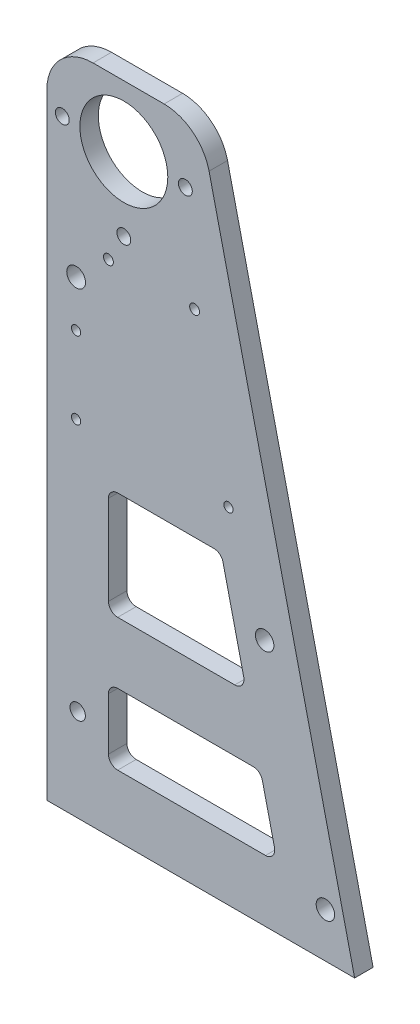
from build123d import *

# Parameters (mm, degrees)
ESBO_O1_R                = 14.2875
ESBO_O1_R_2              = 2.5
RESSALTO_EXTRUS_O2_DEPTH = 6
FILETE1_R                = 15
ESBO_O3_R                = 1.5
ESBO_O3_R_2              = 3
ESBO_O3_R_3              = 3.05
CORTE_EXTRUS_O1_DEPTH    = 238.194013415
ESBO_O5_R                = 2.25
ESBO_O5_R_2              = 3
ESBO_O5_R_3              = 1.6
CORTE_EXTRUS_O2_DEPTH    = 238.194013415


with BuildPart() as part:
    # Esboço1 → Ressalto-extrusão2 (new body)
    with BuildSketch(Plane.XY):
        Polygon((0, 0), (0, 215), (50, 215), (100, 0), align=None)
        with Locations((25, 195)):
            Circle(ESBO_O1_R, mode=Mode.SUBTRACT)
        with Locations((10, 30)):
            Circle(ESBO_O1_R_2, mode=Mode.SUBTRACT)
        with BuildLine():
            Line((20, 95), (20, 66))
            ThreePointArc((20, 66), (20.878679656, 63.878679656), (23, 63))
            Line((23, 63), (61.03739436, 63))
            ThreePointArc((61.03739436, 63), (63.386715693, 64.134339454), (63.959418441, 66.679540484))
            Line((63.959418441, 66.679540484), (57.215232395, 95.679540484))
            ThreePointArc((57.215232395, 95.679540484), (56.15886886, 97.349321333), (54.293208314, 98))
            Line((54.293208314, 98), (23, 98))
            ThreePointArc((23, 98), (20.878679656, 97.121320344), (20, 95))
        make_face(mode=Mode.SUBTRACT)
        with BuildLine():
            Line((20, 40), (20, 23))
            ThreePointArc((20, 23), (20.878679656, 20.878679656), (23, 20))
            Line((23, 20), (71.03739436, 20))
            ThreePointArc((71.03739436, 20), (73.386715693, 21.134339454), (73.959418441, 23.679540484))
            Line((73.959418441, 23.679540484), (70.005930069, 40.679540484))
            ThreePointArc((70.005930069, 40.679540484), (68.949566534, 42.349321333), (67.083905988, 43))
            Line((67.083905988, 43), (23, 43))
            ThreePointArc((23, 43), (20.878679656, 42.121320344), (20, 40))
        make_face(mode=Mode.SUBTRACT)
    extrude(amount=RESSALTO_EXTRUS_O2_DEPTH)

    # Filete1
    filete1_edges = [part.edges().sort_by_distance(p)[0] for p in [
        (0, 215, 3),
        (50, 215, 3),
    ]]
    fillet(filete1_edges, radius=FILETE1_R)

    # Esboço3 → Corte-extrusão1 (cut, through all)
    with BuildSketch(Plane(origin=(0, 0, 0), x_dir=(-1, 0, 0), z_dir=(0, 0, -1))):
        with Locations((-9.5, 112)):
            Circle(ESBO_O3_R)
        with Locations((-90.5, 14.5)):
            Circle(ESBO_O3_R_2)
        with Locations((-9.5, 137)):
            Circle(ESBO_O3_R)
        with Locations((-9.5, 152)):
            Circle(ESBO_O3_R_3)
        with Locations((-59, 112)):
            Circle(ESBO_O3_R)
    extrude(amount=-CORTE_EXTRUS_O1_DEPTH, mode=Mode.SUBTRACT)

    # Esboço5 → Corte-extrusão2 (cut, through all)
    with BuildSketch(Plane(origin=(0, 0, 0), x_dir=(-1, 0, 0), z_dir=(0, 0, -1))):
        with Locations((-25, 171.1875)):
            Circle(ESBO_O5_R)
        with Locations((-70.759810426, 80.398555206)):
            Circle(ESBO_O5_R_2)
        with Locations((-20, 162.1875)):
            Circle(ESBO_O5_R_3)
        with Locations((-48, 162.1875)):
            Circle(ESBO_O5_R_3)
        with Locations((-45, 195)):
            Circle(ESBO_O5_R)
        with Locations((-5, 195)):
            Circle(ESBO_O5_R)
    extrude(amount=-CORTE_EXTRUS_O2_DEPTH, mode=Mode.SUBTRACT)


solid = part.part
